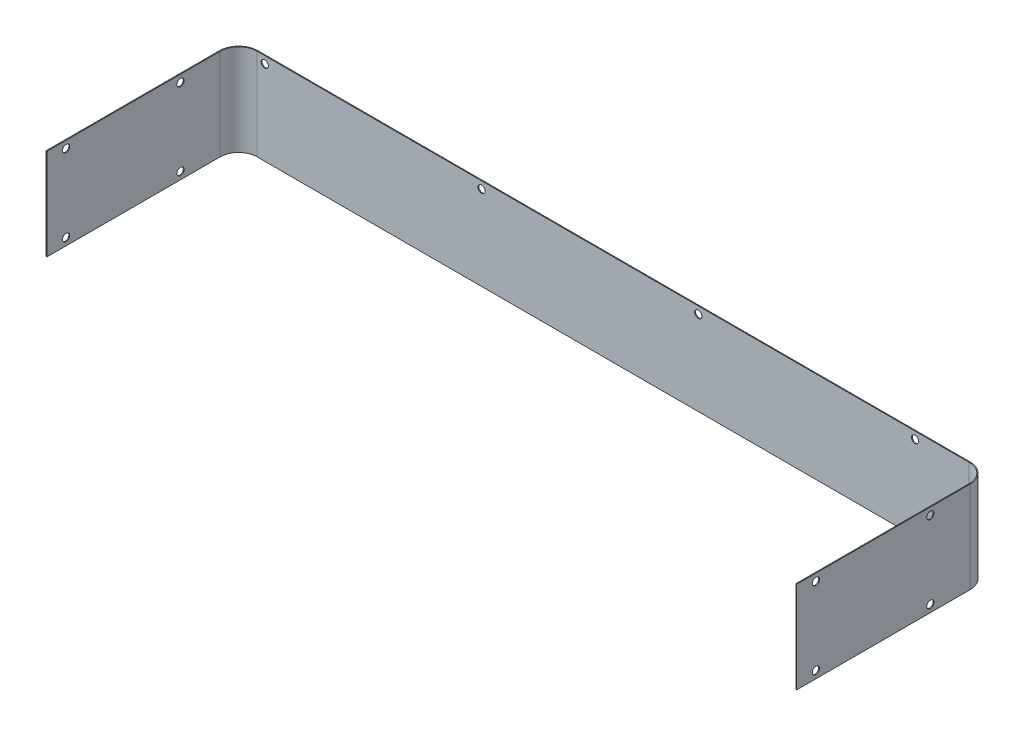
from build123d import *

# Parameters (mm, degrees)
BASE_FLANGE1_DEPTH = 76
SKETCH2_R          = 3
CUT_EXTRUDE1_DEPTH = 649.076816435
SKETCH3_R          = 3
CUT_EXTRUDE2_DEPTH = 10


# Read off the part's stored shape, not the designer's step: Base-Flange1
with BuildPart() as part:
    # Base-Flange1 outline → Base-Flange1 (new body)
    with BuildSketch(Plane(origin=(0, 0, 0), x_dir=(1, 0, 0), z_dir=(0, 1, 0))):
        with BuildLine():
            Line((622.7, 144), (622.7, 0))
            Line((622.7, 0), (623.4, 0))
            Line((623.4, 0), (623.4, 144))
            ThreePointArc((623.4, 144), (618.713708499, 155.313708499), (607.4, 160))
            Line((607.4, 160), (16, 160))
            ThreePointArc((16, 160), (4.686291501, 155.313708499), (0, 144))
            Line((0, 144), (0, 0))
            Line((0, 0), (0.7, 0))
            Line((0.7, 0), (0.7, 144))
            ThreePointArc((0.7, 144), (5.181266248, 154.818733752), (16, 159.3))
            Line((16, 159.3), (607.4, 159.3))
            ThreePointArc((607.4, 159.3), (618.218733752, 154.818733752), (622.7, 144))
        make_face()
    extrude(amount=BASE_FLANGE1_DEPTH)

    # Sketch2 → Cut-Extrude1 (cut, through all)
    with BuildSketch(Plane(origin=(623.4, 0, 0), x_dir=(0, 0, -1), z_dir=(1, 0, 0))):
        with Locations((16, 70)):
            Circle(SKETCH2_R)
        with Locations((111, 70)):
            Circle(SKETCH2_R)
        with Locations(Location((111, 6, 0), (0, 0, 180))):
            Circle(SKETCH2_R)
        with Locations(Location((16, 6, 0), (0, 0, 180))):
            Circle(SKETCH2_R)
    extrude(amount=-CUT_EXTRUDE1_DEPTH, mode=Mode.SUBTRACT)

    # Sketch3 → Cut-Extrude2 (cut)
    with BuildSketch(Plane(origin=(0, 0, -160), x_dir=(-1, 0, 0), z_dir=(0, 0, -1))):
        with Locations((-562.4, 70)):
            Circle(SKETCH3_R)
        with Locations((-382.4, 70)):
            Circle(SKETCH3_R)
        with Locations((-202.4, 70)):
            Circle(SKETCH3_R)
        with Locations((-22.4, 70)):
            Circle(SKETCH3_R)
        with Locations((157.6, 70)):
            Circle(SKETCH3_R)
        with Locations((337.6, 70)):
            Circle(SKETCH3_R)
        with Locations((517.6, 70)):
            Circle(SKETCH3_R)
        with Locations((-382.4, -22)):
            Circle(SKETCH3_R)
        with Locations((-202.4, -22)):
            Circle(SKETCH3_R)
        with Locations((-22.4, -22)):
            Circle(SKETCH3_R)
        with Locations((157.6, -22)):
            Circle(SKETCH3_R)
        with Locations((337.6, -22)):
            Circle(SKETCH3_R)
        with Locations((517.6, -22)):
            Circle(SKETCH3_R)
        with Locations((-562.4, -22)):
            Circle(SKETCH3_R)
    extrude(amount=-CUT_EXTRUDE2_DEPTH, mode=Mode.SUBTRACT)


solid = part.part
